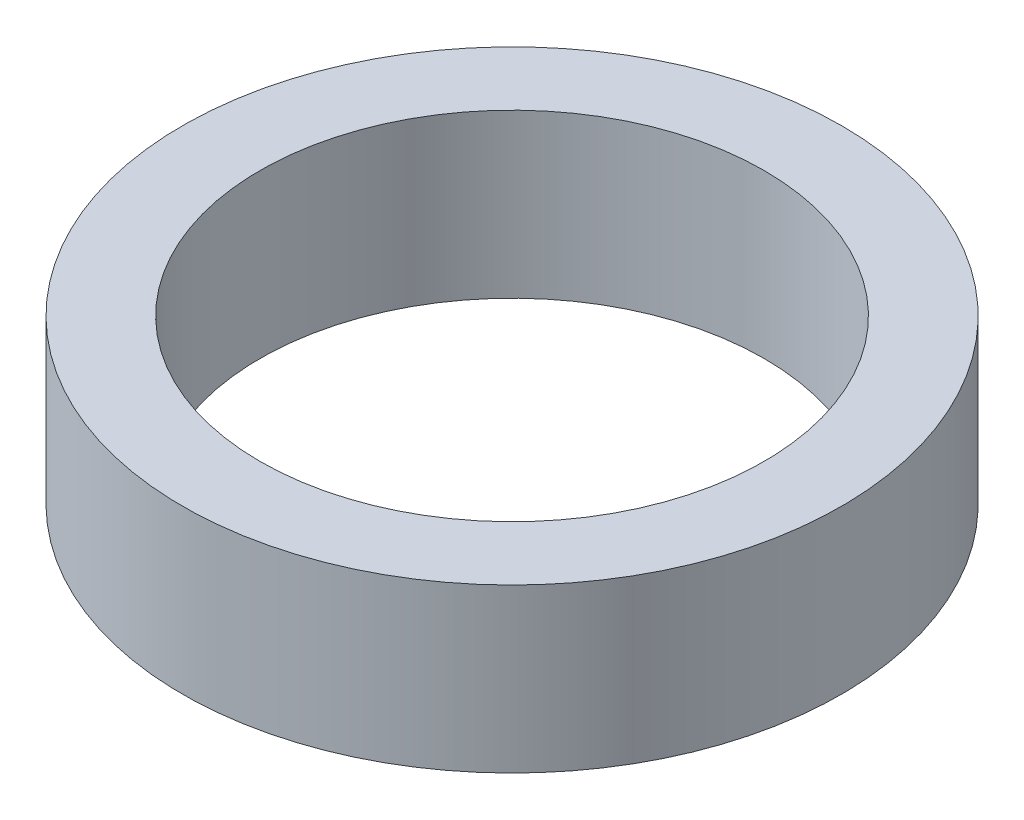
from build123d import *

# Parameters (mm, degrees)
SKETCH1_R           = 42.5
BOSS_EXTRUDE1_DEPTH = 21
SKETCH2_R           = 32.5
CUT_EXTRUDE1_DEPTH  = 64.667102965


with BuildPart() as part:
    # Sketch1 → Boss-Extrude1 (new body)
    with BuildSketch(Plane(origin=(0, 0, 0), x_dir=(1, 0, 0), z_dir=(0, 1, 0))):
        Circle(SKETCH1_R)
    extrude(amount=BOSS_EXTRUDE1_DEPTH)

    # Sketch2 → Cut-Extrude1 (cut, through all)
    with BuildSketch(Plane(origin=(0, 0, 0), x_dir=(1, 0, 0), z_dir=(0, 1, 0))):
        Circle(SKETCH2_R)
    extrude(amount=CUT_EXTRUDE1_DEPTH, mode=Mode.SUBTRACT)


solid = part.part
